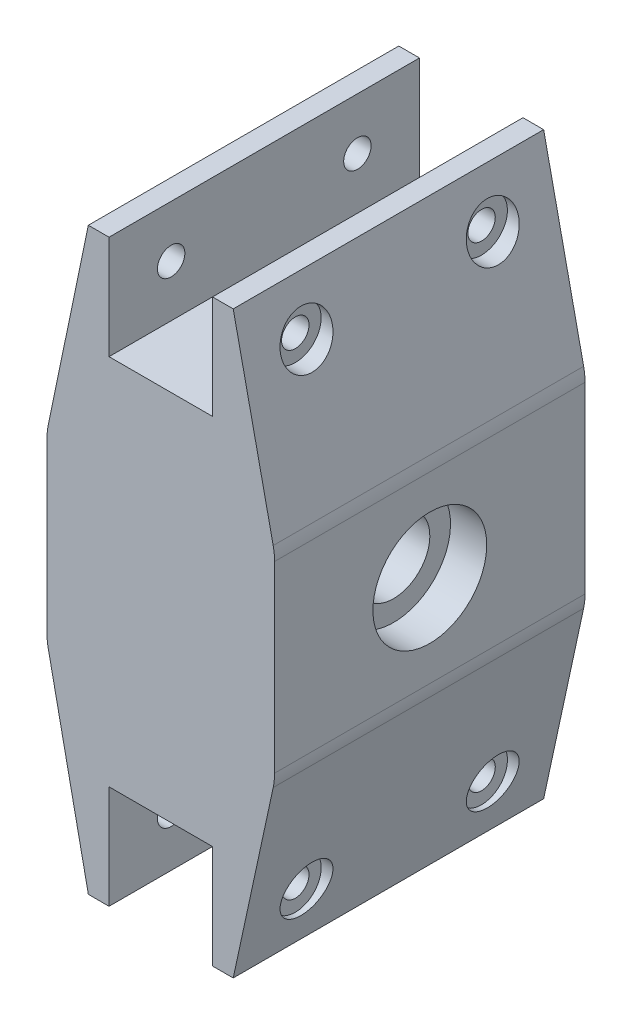
from build123d import *

# Parameters (mm, degrees)
BOSS_EXTRUDE1_DEPTH = 60
SKETCH2_R           = 7
CUT_EXTRUDE1_DEPTH  = 94.123573815
SKETCH3_R           = 11
CUT_EXTRUDE2_DEPTH  = 7
CUT_EXTRUDE3_START  = -7
SKETCH4_R           = 11
CUT_EXTRUDE3_DEPTH  = 7
SKETCH5_R           = 2.65
CUT_EXTRUDE4_DEPTH  = 92.301697684
SKETCH6_R           = 5
CUT_EXTRUDE5_DEPTH  = 4
FILLET1_R           = 12
CUT_EXTRUDE6_START  = 4
SKETCH7_R           = 5
CUT_EXTRUDE6_DEPTH  = 4


with BuildPart() as part:
    # Sketch1 → Boss-Extrude1 (new body)
    with BuildSketch(Plane.XY):
        Polygon((-10, -56), (-10, -36), (10, -36), (10, -56), (14, -56), (22, -19), (22, 19), (14, 56), (10, 56), (10, 36), (-10, 36), (-10, 56), (-14, 56), (-22, 17.5), (-22, -17.5), (-14, -56), align=None)
    extrude(amount=BOSS_EXTRUDE1_DEPTH)

    # Sketch2 → Cut-Extrude1 (cut, through all)
    with BuildSketch(Plane.ZY.offset(22)):
        with Locations((30, 0)):
            Circle(SKETCH2_R)
    extrude(amount=-CUT_EXTRUDE1_DEPTH, mode=Mode.SUBTRACT)

    # Sketch3 → Cut-Extrude2 (cut)
    with BuildSketch(Plane.ZY.offset(22)):
        with Locations((30, 0)):
            Circle(SKETCH3_R)
    extrude(amount=-CUT_EXTRUDE2_DEPTH, mode=Mode.SUBTRACT)

    # Sketch4 → Cut-Extrude3 (cut)
    with BuildSketch(Plane(origin=(22, 0, 0), x_dir=(0, 0, -1), z_dir=(1, 0, 0)).offset(CUT_EXTRUDE3_START)):
        with Locations((-30, 0)):
            Circle(SKETCH4_R)
    extrude(amount=CUT_EXTRUDE3_DEPTH, mode=Mode.SUBTRACT)

    # Sketch5 → Cut-Extrude4 (cut, through all)
    with BuildSketch(Plane(origin=(-18, 0, 0), x_dir=(0, 0, -1), z_dir=(1, 0, 0))):
        with Locations((-12, 46)):
            Circle(SKETCH5_R)
        with Locations((-48, 46)):
            Circle(SKETCH5_R)
    cut_extrude4 = extrude(amount=CUT_EXTRUDE4_DEPTH, mode=Mode.SUBTRACT)

    # Sketch6 → Cut-Extrude5 (cut)
    with BuildSketch(Plane(origin=(-18, 0, 0), x_dir=(0, 0, -1), z_dir=(1, 0, 0))):
        with Locations((-12, 46)):
            Circle(SKETCH6_R)
        with Locations((-48, 46)):
            Circle(SKETCH6_R)
    cut_extrude5 = extrude(amount=CUT_EXTRUDE5_DEPTH, mode=Mode.SUBTRACT)

    # Mirror3: Cut-Extrude4, Cut-Extrude5 across plane
    add(cut_extrude4.mirror(Plane.ZX), mode=Mode.SUBTRACT)
    add(cut_extrude5.mirror(Plane.ZX), mode=Mode.SUBTRACT)

    # Fillet1
    fillet1_edges = [part.edges().sort_by_distance(p)[0] for p in [
        (-22, -17.5, 30),
        (-22, 17.5, 30),
        (22, -19, 30),
        (22, 19, 30),
    ]]
    fillet(fillet1_edges, radius=FILLET1_R)

    # Sketch7 → Cut-Extrude6 (cut)
    with BuildSketch(Plane.ZY.offset(-18).offset(CUT_EXTRUDE6_START)):
        with Locations((12, 46)):
            Circle(SKETCH7_R)
        with Locations((48, 46)):
            Circle(SKETCH7_R)
    cut_extrude6 = extrude(amount=-CUT_EXTRUDE6_DEPTH, mode=Mode.SUBTRACT)

    # Mirror5: Cut-Extrude6 across plane
    add(cut_extrude6.mirror(Plane.ZX), mode=Mode.SUBTRACT)


solid = part.part
